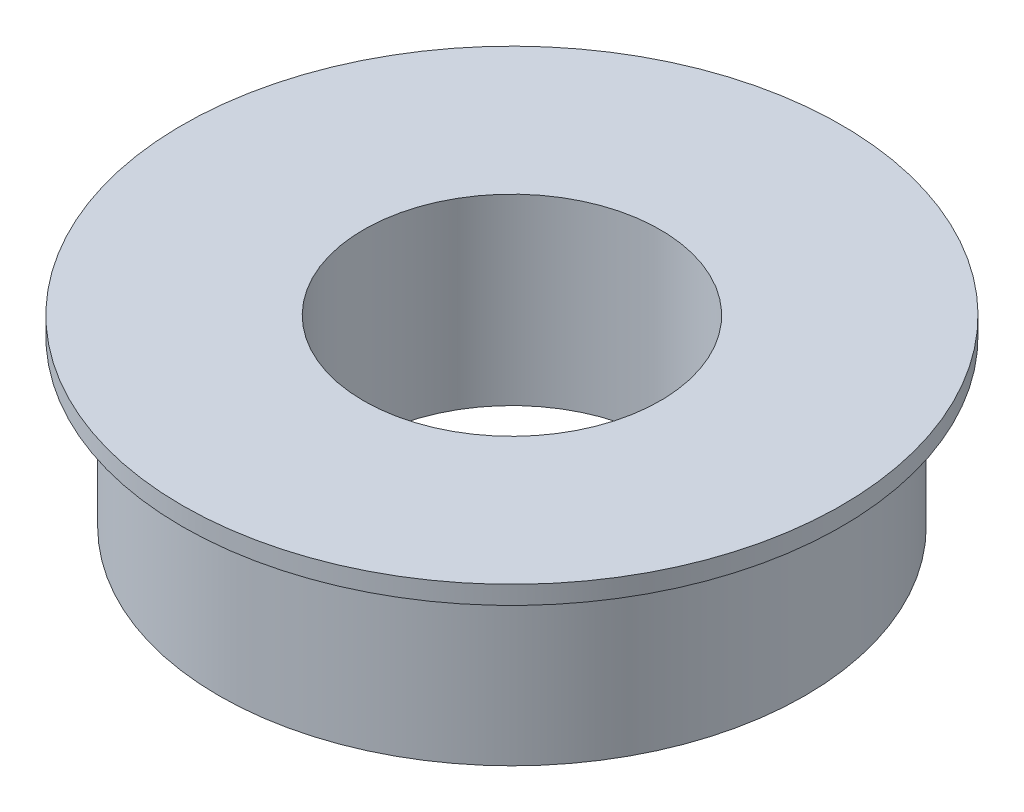
from build123d import *

# Parameters (mm, degrees)
SKETCH1_R           = 8
BOSS_EXTRUDE1_DEPTH = 4.5
SKETCH2_R           = 9
BOSS_EXTRUDE2_DEPTH = 0.5
SKETCH3_R           = 4.05
CUT_EXTRUDE1_DEPTH  = 14.674794331


with BuildPart() as part:
    # Sketch1 → Boss-Extrude1 (new body)
    with BuildSketch(Plane(origin=(0, 0, 0), x_dir=(1, 0, 0), z_dir=(0, 1, 0))):
        Circle(SKETCH1_R)
    extrude(amount=BOSS_EXTRUDE1_DEPTH)

    # Sketch2 → Boss-Extrude2 (add)
    with BuildSketch(Plane(origin=(0, 4.5, 0), x_dir=(1, 0, 0), z_dir=(0, 1, 0))):
        Circle(SKETCH2_R)
    extrude(amount=BOSS_EXTRUDE2_DEPTH)

    # Sketch3 → Cut-Extrude1 (cut, through all)
    with BuildSketch(Plane(origin=(0, 5, 0), x_dir=(1, 0, 0), z_dir=(0, 1, 0))):
        Circle(SKETCH3_R)
    extrude(amount=-CUT_EXTRUDE1_DEPTH, mode=Mode.SUBTRACT)


solid = part.part
